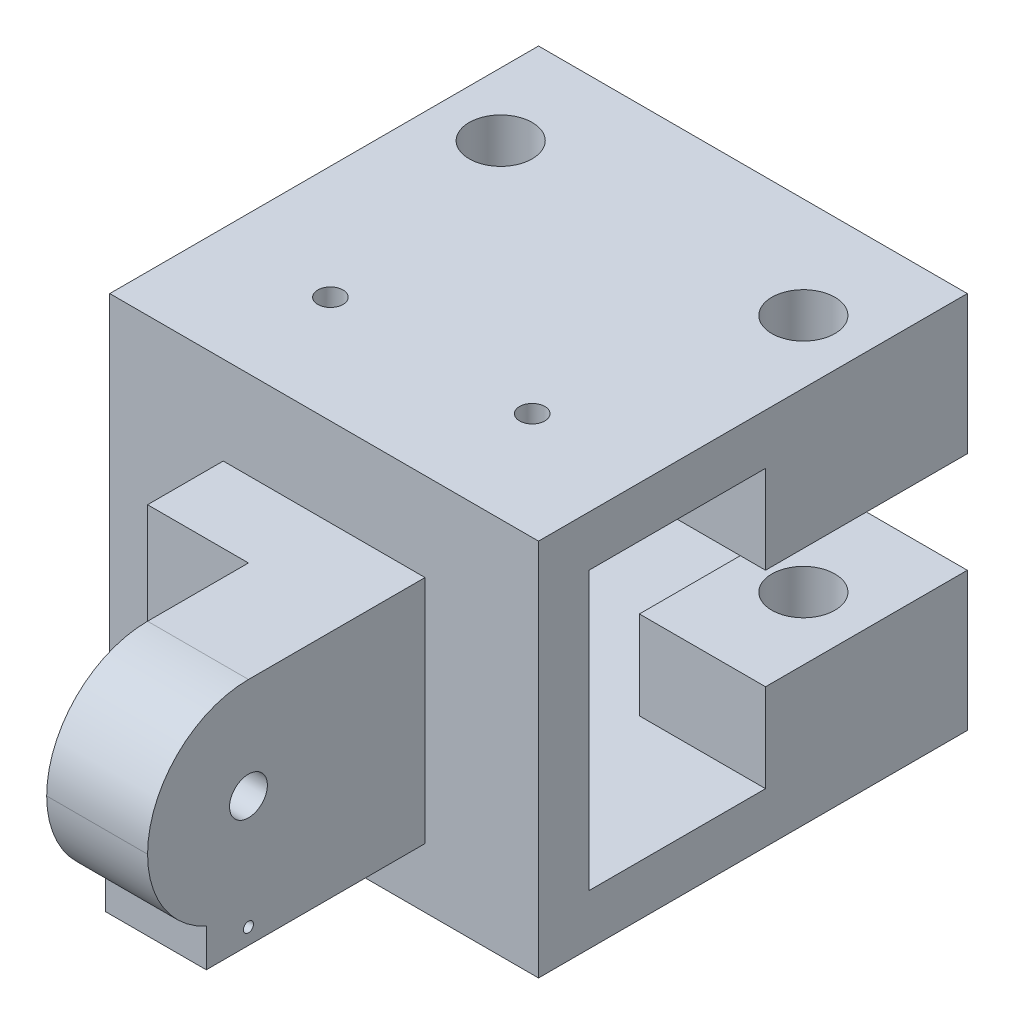
from build123d import *

# Parameters (mm, degrees)
SKETCH_1_W          = 25
SKETCH_1_H          = 80
SKETCH_1_W_2        = 30
EXTRUDE_1_DEPTH     = 30
SKETCH_2_W          = 40
SKETCH_2_H          = 80
EXTRUDE_2_DEPTH     = 80
FILLET_1_R          = 40
SKETCH_3_R          = 7.5
CUT_EXTRUDE_1_DEPTH = 142.774468788
SKETCH_6_W          = 170
SKETCH_6_H          = 150
EXTRUDE_5_DEPTH     = 20
SKETCH_7_W          = 170
SKETCH_7_H          = 20
EXTRUDE_6_DEPTH     = 150
EXTRUDE_7_DEPTH     = 40
SKETCH_10_R         = 2
CUT_EXTRUDE_3_DEPTH = 241.312296814
SKETCH_11_W         = 50
SKETCH_11_H         = 80
EXTRUDE_8_DEPTH     = 110
SKETCH_12_W         = 80
SKETCH_12_H         = 40
CUT_EXTRUDE_4_DEPTH = 267.505159425
SKETCH_13_R         = 12.5
CUT_EXTRUDE_5_DEPTH = 259.89186932
SKETCH_14_R         = 5
CUT_EXTRUDE_6_DEPTH = 259.89186932
SKETCH_15_W         = 21.752867029
SKETCH_15_H         = 110
EXTRUDE_9_DEPTH     = 50
SKETCH_16_R         = 2
CUT_EXTRUDE_7_DEPTH = 21.752867029
SKETCH_17_R         = 2
CUT_EXTRUDE_8_DEPTH = 20


with BuildPart() as part:
    # 草图1 → 凸台-拉伸1 (new body)
    with BuildSketch(Plane.XY):
        with Locations((12.5, -40)):
            Rectangle(SKETCH_1_W, SKETCH_1_H)
        with Locations((40, -40)):
            Rectangle(SKETCH_1_W_2, SKETCH_1_H)
        with Locations((67.5, -40)):
            Rectangle(SKETCH_1_W, SKETCH_1_H)
    extrude(amount=EXTRUDE_1_DEPTH)

    # 草图2 → 凸台-拉伸2 (add)
    with BuildSketch(Plane.XY.offset(30)):
        with Locations((60, -40)):
            Rectangle(SKETCH_2_W, SKETCH_2_H)
    extrude(amount=EXTRUDE_2_DEPTH)

    # 圆角1
    fillet_1_edges = [part.edges().sort_by_distance(p)[0] for p in [
        (60, 0, 110),
        (60, -80, 110),
    ]]
    fillet(fillet_1_edges, radius=FILLET_1_R - 0.0001)  # a hair under: the kernel refuses the full size

    # 草图3 → 切除-拉伸1 (cut, through all)
    with BuildSketch(Plane.ZY.offset(-40)):
        with Locations(Location((70, -40, 0), (0, 0, 270))):
            Circle(SKETCH_3_R)
    extrude(amount=-CUT_EXTRUDE_1_DEPTH, mode=Mode.SUBTRACT)



with BuildPart() as body_2:
    # 草图6 → 凸台-拉伸5 (new body)
    with BuildSketch(Plane(origin=(0, 0, 0), x_dir=(-1, 0, 0), z_dir=(0, 0, -1))):
        with Locations((-40, -40)):
            Rectangle(SKETCH_6_W, SKETCH_6_H)
    extrude(amount=EXTRUDE_5_DEPTH)

    # 草图7 → 凸台-拉伸6 (add)
    with BuildSketch(Plane(origin=(0, 0, -20), x_dir=(-1, 0, 0), z_dir=(0, 0, -1))):
        with Locations((-40, 25)):
            Rectangle(SKETCH_7_W, SKETCH_7_H)
        with Locations((-40, -105)):
            Rectangle(SKETCH_7_W, SKETCH_7_H)
    extrude(amount=EXTRUDE_6_DEPTH)


with BuildPart() as part_1:
    add(part.part)

    add(body_2.part)  # 凸台-拉伸7 merges body 2
    # 草图9 → 凸台-拉伸7 (add)
    with BuildSketch(Plane(origin=(80, 0, 0), x_dir=(0, 0, -1), z_dir=(1, 0, 0))):
        with BuildLine():
            ThreePointArc((-70, -80), (-78.559038333, -79.073557079), (-86.721603642, -76.337143141))
            Line((-86.721603642, -76.337143141), (-86.721603642, -91.337143141))
            Line((-86.721603642, -91.337143141), (0, -91.337143141))
            Line((0, -91.337143141), (0, -80))
            Line((0, -80), (-70, -80))
        make_face()
    extrude(amount=-EXTRUDE_7_DEPTH)

    # 草图10 → 切除-拉伸3 (cut, through all)
    with BuildSketch(Plane(origin=(80, 0, 0), x_dir=(0, 0, -1), z_dir=(1, 0, 0))):
        with Locations(Location((-70, -85, 0), (0, 0, 90))):
            Circle(SKETCH_10_R)
    extrude(amount=-CUT_EXTRUDE_3_DEPTH, mode=Mode.SUBTRACT)

    # 草图11 → 凸台-拉伸8 (add)
    with BuildSketch(Plane(origin=(0, -95, 0), x_dir=(1, 0, 0), z_dir=(0, 1, 0))):
        with Locations((-20, 130)):
            Rectangle(SKETCH_11_W, SKETCH_11_H)
        with Locations((100, 130)):
            Rectangle(SKETCH_11_W, SKETCH_11_H)
    extrude(amount=EXTRUDE_8_DEPTH)

    # 草图12 → 切除-拉伸4 (cut, through all)
    with BuildSketch(Plane(origin=(125, 0, 0), x_dir=(0, 0, -1), z_dir=(1, 0, 0))):
        with Locations((130, -40)):
            Rectangle(SKETCH_12_W, SKETCH_12_H)
    extrude(amount=-CUT_EXTRUDE_4_DEPTH, mode=Mode.SUBTRACT)

    # 草图13 → 切除-拉伸5 (cut, through all)
    with BuildSketch(Plane(origin=(0, 35, 0), x_dir=(1, 0, 0), z_dir=(0, 1, 0))):
        with Locations(Location((100, 130, 0), (0, 0, 180))):
            Circle(SKETCH_13_R)
        with Locations(Location((-20, 130, 0), (0, 0, 180))):
            Circle(SKETCH_13_R)
    extrude(amount=-CUT_EXTRUDE_5_DEPTH, mode=Mode.SUBTRACT)

    # 草图14 → 切除-拉伸6 (cut, through all)
    with BuildSketch(Plane.XZ.offset(115)):
        with Locations((0, -42.5)):
            Circle(SKETCH_14_R)
        with Locations(Location((80, -42.5, 0), (0, 0, 90))):
            Circle(SKETCH_14_R)
    extrude(amount=-CUT_EXTRUDE_6_DEPTH, mode=Mode.SUBTRACT)

    # 草图15 → 凸台-拉伸9 (add)
    with BuildSketch(Plane(origin=(0, 0, -20), x_dir=(-1, 0, 0), z_dir=(0, 0, -1))):
        with Locations((34.123566485, -40)):
            Rectangle(SKETCH_15_W, SKETCH_15_H)
    extrude(amount=EXTRUDE_9_DEPTH)

    # 草图16 → 切除-拉伸7 (cut)
    with BuildSketch(Plane.ZY.offset(45)):
        with Locations(Location((-20, -80, 0), (0, 0, 270))):
            Circle(SKETCH_16_R)
        with Locations(Location((-40, -80, 0), (0, 0, 270))):
            Circle(SKETCH_16_R)
    extrude(amount=-CUT_EXTRUDE_7_DEPTH, mode=Mode.SUBTRACT)

    # 草图17 → 切除-拉伸8 (cut)
    with BuildSketch(Plane.XZ.offset(115)):
        with Locations((-25, -110)):
            Circle(SKETCH_17_R)
        with Locations((25, -110)):
            Circle(SKETCH_17_R)
    extrude(amount=-CUT_EXTRUDE_8_DEPTH, mode=Mode.SUBTRACT)


solid = part_1.part
